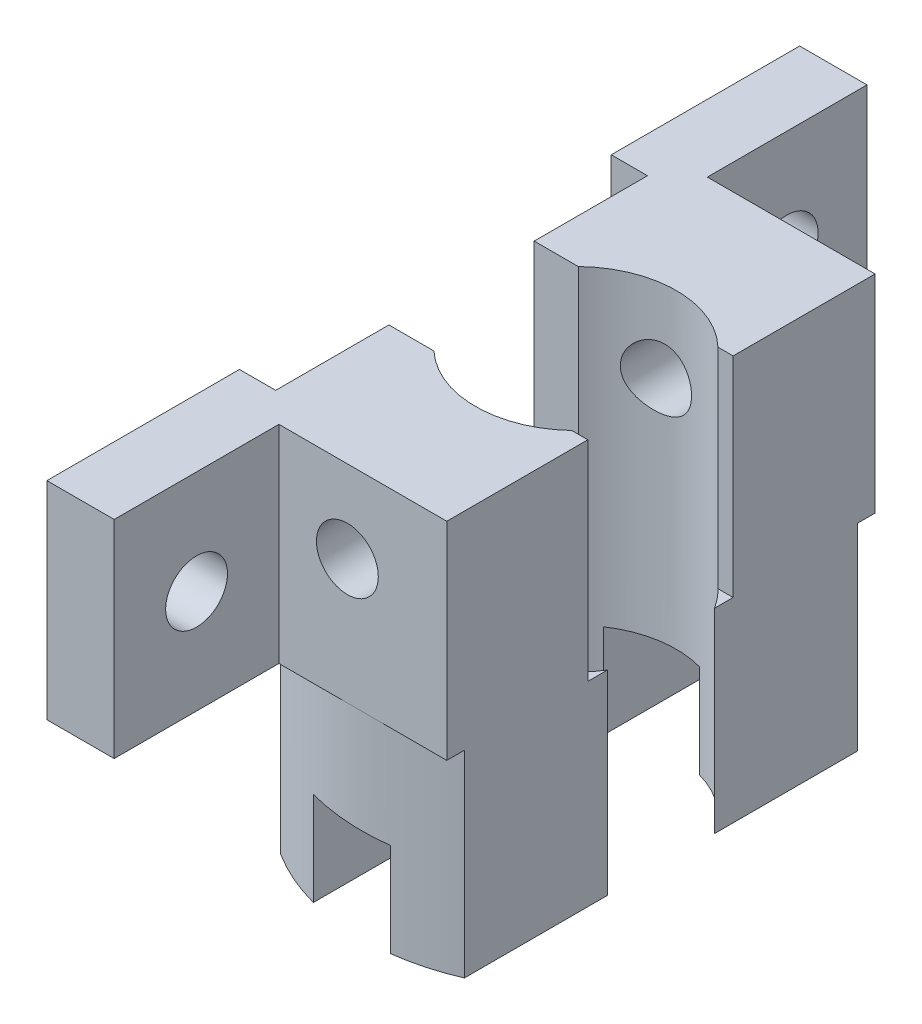
from build123d import *

# Parameters (mm, degrees)
SKETCH_1_R           = 20.68
SKETCH_1_R_2         = 9.68
EXTRUDE_1_DEPTH      = 116.68
SKETCH_11_W          = 27
SKETCH_11_H          = 150
CUT_EXTRUDE_3_DEPTH  = 40
SKETCH_13_W          = 10
SKETCH_13_H          = 128.345013401
CUT_EXTRUDE_7_DEPTH  = 126.614916312
SKETCH_15_W          = 8
SKETCH_15_H          = 68.68
CUT_EXTRUDE_9_DEPTH  = 48
SKETCH_16_W          = 15.549431524
SKETCH_16_H          = 20
SKETCH_16_W_2        = 15.459431524
EXTRUDE_4_DEPTH      = 19.2
SKETCH_17_W          = 19.20851187
SKETCH_17_H          = 14.03
CUT_EXTRUDE_10_DEPTH = 20.2
SKETCH_18_R          = 9.59
CUT_EXTRUDE_11_DEPTH = 121.289430957
SKETCH_21_R          = 2.985
CUT_EXTRUDE_12_DEPTH = 55.2
EXTRUDE_START        = 55.2
SKETCH_24_R          = 20.59
SKETCH_24_R_2        = 9.59
EXTRUDE_2_DEPTH      = 55.2
CUT_EXTRUDE_13_DEPTH = 55.2
SKETCH_26_W          = 10.00851187
SKETCH_26_H          = 41.68
CUT_EXTRUDE_15_DEPTH = 55.2
SKETCH_27_W          = 10
SKETCH_27_H          = 40
CUT_EXTRUDE_16_DEPTH = 55.2
SKETCH_28_W          = 44.880694938
SKETCH_28_H          = 9.608044066
CUT_EXTRUDE_17_DEPTH = 12.2
SKETCH_35_W          = 13.53
SKETCH_35_H          = 20
EXTRUDE_10_DEPTH     = 15
EXTRUDE_11_DEPTH     = 15
SKETCH_37_W          = 9
SKETCH_37_H          = 20
EXTRUDE_12_DEPTH     = 20
SKETCH_38_W          = 9
SKETCH_38_H          = 20
EXTRUDE_13_DEPTH     = 20
SKETCH_42_R          = 2.985
CUT_EXTRUDE_21_DEPTH = 20
CUT_EXTRUDE_23_DEPTH = 138.235841092
SKETCH_45_W          = 3
SKETCH_45_H          = 20
EXTRUDE_14_DEPTH     = 30
SKETCH_46_W          = 3
SKETCH_46_H          = 20
EXTRUDE_15_DEPTH     = 30
SKETCH_47_W          = 33.078221107
SKETCH_47_H          = 20
EXTRUDE_16_DEPTH     = 50
SKETCH_48_W          = 30
SKETCH_48_H          = 20
EXTRUDE_17_DEPTH     = 50
SKETCH_50_W          = 50
SKETCH_50_H          = 20
EXTRUDE_18_DEPTH     = 1
SKETCH_51_W          = 50
SKETCH_51_H          = 20
EXTRUDE_19_DEPTH     = 1
SKETCH_52_W          = 53
SKETCH_52_H          = 14
CUT_EXTRUDE_24_DEPTH = 151.972575738
SKETCH_53_W          = 53
SKETCH_53_H          = 14
CUT_EXTRUDE_25_DEPTH = 151.942387436
SKETCH_54_W          = 40
SKETCH_54_H          = 73.27
CUT_EXTRUDE_26_DEPTH = 147.866192927
SKETCH_56_W          = 13.00851187
SKETCH_56_H          = 20
EXTRUDE_21_DEPTH     = 3.08
SKETCH_58_W          = 44.672014854
SKETCH_58_H          = 95.939897673
CUT_EXTRUDE_28_DEPTH = 149.701311438
SKETCH_59_R          = 9.7
CUT_EXTRUDE_29_DEPTH = 60.553551814
SKETCH_60_W          = 6.504255935
SKETCH_60_H          = 76.35
CUT_EXTRUDE_30_DEPTH = 60.553551814
CUT_EXTRUDE_32_DEPTH = 20
SKETCH_64_W          = 16.20851187
SKETCH_64_H          = 0.09
EXTRUDE_22_DEPTH     = 20
SKETCH_65_W          = 3.495744065
SKETCH_65_H          = 3.26
CUT_EXTRUDE_33_DEPTH = 58.582567932
SKETCH_66_W          = 3.495744065
SKETCH_66_H          = 1.776778893
SKETCH_66_W_2        = 3.503635083
SKETCH_66_H_2        = 1.775
EXTRUDE_23_DEPTH     = 20.2
SKETCH_68_W          = 6.504255935
SKETCH_68_H          = 3.66
CUT_EXTRUDE_34_DEPTH = 20
SKETCH_69_R          = 2.985
CUT_EXTRUDE_35_DEPTH = 124.351086443
SKETCH_70_R          = 2.985
CUT_EXTRUDE_36_DEPTH = 131.530092773


with BuildPart() as part:
    # 草圖1 → 伸長-薄件1 (new body)
    with BuildSketch(Plane(origin=(0, 0, 0), x_dir=(1, 0, 0), z_dir=(0, 1, 0))):
        Circle(SKETCH_1_R)
        Circle(SKETCH_1_R_2, mode=Mode.SUBTRACT)
    extrude(amount=EXTRUDE_1_DEPTH)

    # 草圖11 → 除料-伸長3 (cut)
    with BuildSketch(Plane(origin=(0, 116.68, 0), x_dir=(1, 0, 0), z_dir=(0, 1, 0))):
        with Locations((21.70851187, -44.235815192)):
            Rectangle(SKETCH_11_W, SKETCH_11_H)
    extrude(amount=-CUT_EXTRUDE_3_DEPTH, mode=Mode.SUBTRACT)

    # 草圖13 → 除料-伸長7 (cut, through all)
    with BuildSketch(Plane.XY.offset(21)):
        with Locations((-16, 58.612182466)):
            Rectangle(SKETCH_13_W, SKETCH_13_H)
    extrude(amount=-CUT_EXTRUDE_7_DEPTH, mode=Mode.SUBTRACT)

    # 草圖15 → 除料-伸長9 (cut)
    with BuildSketch(Plane.XY.offset(21)):
        with Locations((-1.395744065, 52.34)):
            Rectangle(SKETCH_15_W, SKETCH_15_H)
    extrude(amount=-CUT_EXTRUDE_9_DEPTH, mode=Mode.SUBTRACT)

    # 草圖16 → 填料-伸長4 (add)
    with BuildSketch(Plane(origin=(8.20851187, 0, 0), x_dir=(0, 0, -1), z_dir=(1, 0, 0))):
        with Locations((12.905284238, 106.68)):
            Rectangle(SKETCH_16_W, SKETCH_16_H)
        with Locations((-12.860284238, 106.68)):
            Rectangle(SKETCH_16_W_2, SKETCH_16_H)
    extrude(amount=-EXTRUDE_4_DEPTH)

    # 草圖17 → 除料-伸長10 (cut)
    with BuildSketch(Plane(origin=(0, 116.68, 0), x_dir=(1, 0, 0), z_dir=(0, 1, 0))):
        with Locations((-1.395744065, -0.045)):
            Rectangle(SKETCH_17_W, SKETCH_17_H)
    extrude(amount=-CUT_EXTRUDE_10_DEPTH, mode=Mode.SUBTRACT)

    # 草圖18 → 除料-伸長11 (cut, through all)
    with BuildSketch(Plane.XZ):
        Circle(SKETCH_18_R)
    extrude(amount=-CUT_EXTRUDE_11_DEPTH, mode=Mode.SUBTRACT)

    # 草圖21 → 除料-伸長12 (cut)
    with BuildSketch(Plane(origin=(0, 0, -20.68), x_dir=(-1, 0, 0), z_dir=(0, 0, -1))):
        with Locations((1.39148813, 108.73)):
            Circle(SKETCH_21_R)
    extrude(amount=-CUT_EXTRUDE_12_DEPTH, mode=Mode.SUBTRACT)

    # 草圖24 → 伸長-薄件2 (add)
    with BuildSketch(Plane.XZ.offset(EXTRUDE_START)):
        Circle(SKETCH_24_R)
        Circle(SKETCH_24_R_2, mode=Mode.SUBTRACT)
    extrude(amount=-EXTRUDE_2_DEPTH)

    # 草圖25 → 除料-伸長13 (cut)
    with BuildSketch(Plane.XY.offset(21)):
        Polygon((-1.39148813, -11.785), (22.612379708, -11.785), (22.612379708, -63.873337429), (-22.749525245, -63.873337429), (-22.749525245, -11.785), align=None)
    extrude(amount=-CUT_EXTRUDE_13_DEPTH, mode=Mode.SUBTRACT)

    # 草圖26 → 除料-伸長15 (cut)
    with BuildSketch(Plane(origin=(0, 0, 0), x_dir=(1, 0, 0), z_dir=(0, 1, 0))):
        with Locations((-15.995744065, -0.16)):
            Rectangle(SKETCH_26_W, SKETCH_26_H)
    extrude(amount=-CUT_EXTRUDE_15_DEPTH, mode=Mode.SUBTRACT)

    # 草圖27 → 除料-伸長16 (cut)
    with BuildSketch(Plane(origin=(21, 0, 0), x_dir=(0, 0, -1), z_dir=(1, 0, 0))):
        with Locations((0, 41.68)):
            Rectangle(SKETCH_27_W, SKETCH_27_H)
    extrude(amount=-CUT_EXTRUDE_16_DEPTH, mode=Mode.SUBTRACT)

    # 草圖28 → 除料-伸長17 (cut)
    with BuildSketch(Plane(origin=(21, 0, 0), x_dir=(0, 0, -1), z_dir=(1, 0, 0))):
        Rectangle(SKETCH_28_W, SKETCH_28_H)
    extrude(amount=-CUT_EXTRUDE_17_DEPTH, mode=Mode.SUBTRACT)

    # 草圖35 → 填料-伸長10 (add)
    with BuildSketch(Plane.ZY.offset(10.99148813)):
        with Locations((13.825, 106.68)):
            Rectangle(SKETCH_35_W, SKETCH_35_H)
    extrude(amount=EXTRUDE_10_DEPTH)

    # 草圖36 → 填料-伸長11 (add)
    with BuildSketch(Plane.ZY.offset(10.99148813)):
        Polygon((-20.68, 116.68), (-6.97, 116.68), (-6.97, 96.48), (-20.68, 96.68), align=None)
    extrude(amount=EXTRUDE_11_DEPTH)

    # 草圖37 → 填料-伸長12 (add)
    with BuildSketch(Plane.XY.offset(20.59)):
        with Locations((-21.49148813, 106.68)):
            Rectangle(SKETCH_37_W, SKETCH_37_H)
    extrude(amount=EXTRUDE_12_DEPTH)

    # 草圖38 → 填料-伸長13 (add)
    with BuildSketch(Plane(origin=(0, 0, -20.68), x_dir=(-1, 0, 0), z_dir=(0, 0, -1))):
        with Locations((21.49148813, 106.68)):
            Rectangle(SKETCH_38_W, SKETCH_38_H)
    extrude(amount=EXTRUDE_13_DEPTH)

    # 草圖42 → 除料-伸長21 (cut)
    with BuildSketch(Plane(origin=(-16.99148813, 0, 0), x_dir=(0, 0, -1), z_dir=(1, 0, 0))):
        with Locations((30.68, 106.554418142)):
            Circle(SKETCH_42_R)
        with Locations((-30.395640125, 106.68)):
            Circle(SKETCH_42_R)
    extrude(amount=-CUT_EXTRUDE_21_DEPTH, mode=Mode.SUBTRACT)

    # 草圖43 → 除料-伸長23 (cut, through all)
    with BuildSketch(Plane(origin=(0, 116.68, 0), x_dir=(1, 0, 0), z_dir=(0, 1, 0))):
        Polygon((-11, 6.97), (-10.99148813, 20.68), (-10.99148813, 48.096794253), (-28.274756234, 48.096794253), (-28.274756234, -43.270506289), (-11, -43.270506289), align=None)
    extrude(amount=-CUT_EXTRUDE_23_DEPTH, mode=Mode.SUBTRACT)

    # 草圖45 → 填料-伸長14 (add)
    with BuildSketch(Plane.XY.offset(20.59)):
        with Locations((-9.5, 106.68)):
            Rectangle(SKETCH_45_W, SKETCH_45_H)
    extrude(amount=EXTRUDE_14_DEPTH)

    # 草圖46 → 填料-伸長15 (add)
    with BuildSketch(Plane(origin=(0, 0, -20.68), x_dir=(-1, 0, 0), z_dir=(0, 0, -1))):
        with Locations((9.49148813, 106.68)):
            Rectangle(SKETCH_46_W, SKETCH_46_H)
    extrude(amount=EXTRUDE_15_DEPTH)

    # 草圖47 → 填料-伸長16 (add)
    with BuildSketch(Plane.ZY.offset(11)):
        with Locations((34.050889447, 106.68)):
            Rectangle(SKETCH_47_W, SKETCH_47_H)
    extrude(amount=EXTRUDE_16_DEPTH)

    # 草圖48 → 填料-伸長17 (add)
    with BuildSketch(Plane.ZY.offset(10.99148813)):
        with Locations((-35.68, 106.68)):
            Rectangle(SKETCH_48_W, SKETCH_48_H)
    extrude(amount=EXTRUDE_17_DEPTH)

    # 草圖50 → 填料-伸長18 (add)
    with BuildSketch(Plane(origin=(0, 0, 17.511778893), x_dir=(-1, 0, 0), z_dir=(0, 0, -1))):
        with Locations((36, 106.68)):
            Rectangle(SKETCH_50_W, SKETCH_50_H)
    extrude(amount=EXTRUDE_18_DEPTH)

    # 草圖51 → 填料-伸長19 (add)
    with BuildSketch(Plane.XY.offset(-20.68)):
        with Locations((-35.99148813, 106.68)):
            Rectangle(SKETCH_51_W, SKETCH_51_H)
    extrude(amount=EXTRUDE_19_DEPTH)

    # 草圖52 → 除料-伸長24 (cut, through all)
    with BuildSketch(Plane(origin=(0, 116.68, 0), x_dir=(1, 0, 0), z_dir=(0, 1, 0))):
        with Locations((-34.49148813, 43.68)):
            Rectangle(SKETCH_52_W, SKETCH_52_H)
    extrude(amount=-CUT_EXTRUDE_24_DEPTH, mode=Mode.SUBTRACT)

    # 草圖53 → 除料-伸長25 (cut, through all)
    with BuildSketch(Plane(origin=(0, 116.68, 0), x_dir=(1, 0, 0), z_dir=(0, 1, 0))):
        with Locations((-34.5, -43.59)):
            Rectangle(SKETCH_53_W, SKETCH_53_H)
    extrude(amount=-CUT_EXTRUDE_25_DEPTH, mode=Mode.SUBTRACT)

    # 草圖54 → 除料-伸長26 (cut, through all)
    with BuildSketch(Plane(origin=(0, 116.68, 0), x_dir=(1, 0, 0), z_dir=(0, 1, 0))):
        with Locations((-41, 0.045)):
            Rectangle(SKETCH_54_W, SKETCH_54_H)
    extrude(amount=-CUT_EXTRUDE_26_DEPTH, mode=Mode.SUBTRACT)

    # 草圖56 → 填料-伸長21 (add)
    with BuildSketch(Plane(origin=(0, 0, -36.68), x_dir=(-1, 0, 0), z_dir=(0, 0, -1))):
        with Locations((14.495744065, 106.68)):
            Rectangle(SKETCH_56_W, SKETCH_56_H)
    extrude(amount=EXTRUDE_21_DEPTH)

    # 草圖58 → 除料-伸長28 (cut, through all)
    with BuildSketch(Plane.XY.offset(50)):
        with Locations((-0.234953045, 29.661774302)):
            Rectangle(SKETCH_58_W, SKETCH_58_H)
    extrude(amount=-CUT_EXTRUDE_28_DEPTH, mode=Mode.SUBTRACT)

    # 草圖59 → 除料-伸長29 (cut, through all)
    with BuildSketch(Plane.XZ.offset(-77.631723139)):
        Circle(SKETCH_59_R)
    extrude(amount=-CUT_EXTRUDE_29_DEPTH, mode=Mode.SUBTRACT)

    # 草圖60 → 除料-伸長30 (cut, through all)
    with BuildSketch(Plane(origin=(0, 116.68, 0), x_dir=(1, 0, 0), z_dir=(0, 1, 0))):
        with Locations((-17.747872032, 1.585)):
            Rectangle(SKETCH_60_W, SKETCH_60_H)
    extrude(amount=-CUT_EXTRUDE_30_DEPTH, mode=Mode.SUBTRACT)

    # 草圖61 → 除料-伸長32 (cut)
    with BuildSketch(Plane(origin=(0, 116.68, 0), x_dir=(1, 0, 0), z_dir=(0, 1, 0))):
        Polygon((1.92725193, -20.59), (1.92725193, -22.399121663), (-2.174190472, -21.421542421), (-2.174190472, -20.59), align=None)
    extrude(amount=-CUT_EXTRUDE_32_DEPTH, mode=Mode.SUBTRACT)

    # 草圖64 → 填料-伸長22 (add)
    with BuildSketch(Plane(origin=(0, 116.68, 0), x_dir=(1, 0, 0), z_dir=(0, 1, 0))):
        with Locations((0.104255935, -20.635)):
            Rectangle(SKETCH_64_W, SKETCH_64_H)
    extrude(amount=-EXTRUDE_22_DEPTH)

    # 草圖65 → 除料-伸長33 (cut, through all)
    with BuildSketch(Plane(origin=(0, 116.68, 0), x_dir=(1, 0, 0), z_dir=(0, 1, 0))):
        with Locations((-12.747872033, -18.141778893)):
            Rectangle(SKETCH_65_W, SKETCH_65_H)
    extrude(amount=-CUT_EXTRUDE_33_DEPTH, mode=Mode.SUBTRACT)

    # 草圖66 → 填料-伸長23 (add)
    with BuildSketch(Plane(origin=(0, 96.48, 0), x_dir=(1, 0, 0), z_dir=(0, 1, 0))):
        with Locations((-12.747872033, -18.883389447)):
            Rectangle(SKETCH_66_W, SKETCH_66_H)
        with Locations((-12.743926524, 18.7925)):
            Rectangle(SKETCH_66_W_2, SKETCH_66_H_2)
    extrude(amount=EXTRUDE_23_DEPTH)

    # 草圖68 → 除料-伸長34 (cut)
    with BuildSketch(Plane(origin=(0, 116.68, 0), x_dir=(1, 0, 0), z_dir=(0, 1, 0))):
        with Locations((-11.243616098, 37.93)):
            Rectangle(SKETCH_68_W, SKETCH_68_H)
    extrude(amount=-CUT_EXTRUDE_34_DEPTH, mode=Mode.SUBTRACT)

    # 草圖69 → 除料-伸長35 (cut, through all)
    with BuildSketch(Plane(origin=(-7.99148813, 0, 0), x_dir=(0, 0, -1), z_dir=(1, 0, 0))):
        with Locations((28.39, 106.68)):
            Circle(SKETCH_69_R)
        with Locations((-28.635, 106.68)):
            Circle(SKETCH_69_R)
    extrude(amount=-CUT_EXTRUDE_35_DEPTH, mode=Mode.SUBTRACT)

    # 草圖70 → 除料-伸長36 (cut, through all)
    with BuildSketch(Plane(origin=(0, 0, 20.59), x_dir=(-1, 0, 0), z_dir=(0, 0, -1))):
        with Locations((1.39148813, 108.73)):
            Circle(SKETCH_70_R)
    extrude(amount=-CUT_EXTRUDE_36_DEPTH, mode=Mode.SUBTRACT)


solid = part.part
